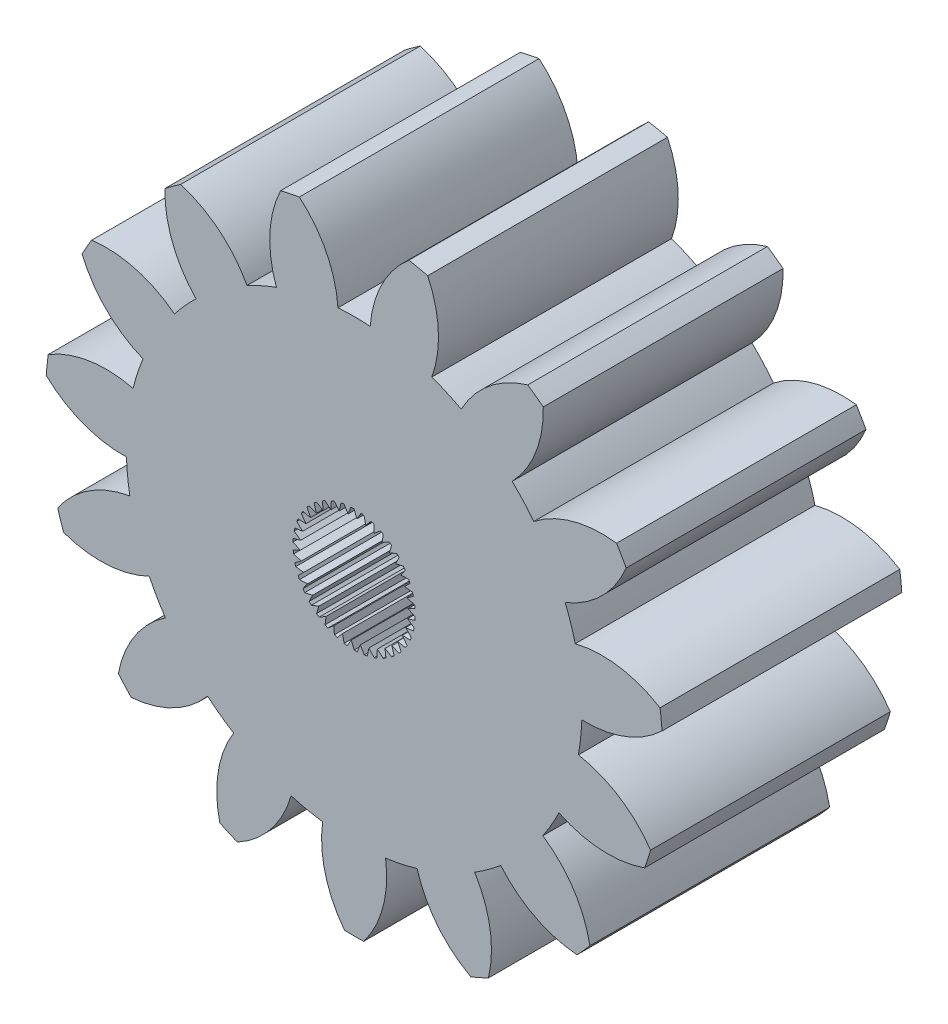
from build123d import *

# Parameters (mm, degrees)
SKETCH1_R           = 70.548036847
BOSS_EXTRUDE1_DEPTH = 10
SKETCH3_R           = 367.512428381
SKETCH3_R_2         = 2.249999999
CUT_EXTRUDE2_DEPTH  = 269.283414963
CUT_EXTRUDE4_DEPTH  = 10


with BuildPart() as part:
    # Sketch1 → Boss-Extrude1 (new body)
    with BuildSketch(Plane.XY):
        Circle(SKETCH1_R)
    extrude(amount=BOSS_EXTRUDE1_DEPTH)

    # Sketch3 → Cut-Extrude2 (cut, through all)
    # profile 1 of 2: a face of its own
    with BuildSketch(Plane(origin=(55.025604462, -141.718387499, 105.594585314), x_dir=(1, 0, 0), z_dir=(0, 0, 1))):
        with Locations((-43.461576529, 148.105383059)):
            Circle(SKETCH3_R)
        with BuildLine():
            ThreePointArc((-38.992966758, 156.489924055), (-37.834855129, 157.900828095), (-36.221197708, 158.75404699))
            ThreePointArc((-36.221197708, 158.75404699), (-35.892665836, 158.523094895), (-35.571495409, 158.28201064))
            ThreePointArc((-35.571495409, 158.28201064), (-35.884307233, 156.483672095), (-36.868280539, 154.946249158))
            ThreePointArc((-36.868280539, 154.946249158), (-36.400957542, 154.46279295), (-35.968998313, 153.947495063))
            ThreePointArc((-35.968998313, 153.947495063), (-34.337144321, 154.765373604), (-32.515959525, 154.888494247))
            ThreePointArc((-32.515959525, 154.888494247), (-32.309767405, 154.543883059), (-32.114421421, 154.193009851))
            ThreePointArc((-32.114421421, 154.193009851), (-33.131639425, 152.677377874), (-34.655870014, 151.673090132))
            ThreePointArc((-34.655870014, 151.673090132), (-34.425588568, 151.041353522), (-34.240564709, 150.394911831))
            ThreePointArc((-34.240564709, 150.394911831), (-32.417130735, 150.478346243), (-30.703317959, 149.850079957))
            ThreePointArc((-30.703317959, 149.850079957), (-30.655118083, 149.45139608), (-30.619373638, 149.051403086))
            ThreePointArc((-30.619373638, 149.051403086), (-32.165111587, 148.080544213), (-33.966046142, 147.783042142))
            ThreePointArc((-33.966046142, 147.783042142), (-34.012624001, 147.112258129), (-34.106527818, 146.446448275))
            ThreePointArc((-34.106527818, 146.446448275), (-32.406802162, 145.78101199), (-31.096695206, 144.509991723))
            ThreePointArc((-31.096695206, 144.509991723), (-31.214821769, 144.126171222), (-31.344859402, 143.746220863))
            ThreePointArc((-31.344859402, 143.746220863), (-33.151845162, 143.488005415), (-34.918085739, 143.948729825))
            ThreePointArc((-34.918085739, 143.948729825), (-35.233469168, 143.354883059), (-35.590063838, 142.784829614))
            ThreePointArc((-35.590063838, 142.784829614), (-34.307944507, 141.485582611), (-33.628072765, 139.791579314))
            ThreePointArc((-33.628072765, 139.791579314), (-33.892100612, 139.488988241), (-34.165435634, 139.194777386))
            ThreePointArc((-34.165435634, 139.194777386), (-35.921224952, 139.693853159), (-37.347372508, 140.833140613))
            ThreePointArc((-37.347372508, 140.833140613), (-37.877028847, 140.418912595), (-38.434655913, 140.04318298))
            ThreePointArc((-38.434655913, 140.04318298), (-37.791832987, 138.334776868), (-37.859752459, 136.510699101))
            ThreePointArc((-37.859752459, 136.510699101), (-38.224028776, 136.341658201), (-38.59339908, 136.184058581))
            ThreePointArc((-38.59339908, 136.184058581), (-39.994400032, 137.354130839), (-40.833860699, 138.974988187))
            ThreePointArc((-40.833860699, 138.974988187), (-41.486207555, 138.812002704), (-42.14844823, 138.695563981))
            ThreePointArc((-42.14844823, 138.695563981), (-42.256071633, 136.873397699), (-43.060038426, 135.234645079))
            ThreePointArc((-43.060038426, 135.234645079), (-43.461576529, 135.228383059), (-43.863114633, 135.234645079))
            ThreePointArc((-43.863114633, 135.234645079), (-44.667081426, 136.873397699), (-44.774704828, 138.695563981))
            ThreePointArc((-44.774704828, 138.695563981), (-45.436945504, 138.812002704), (-46.08929236, 138.974988187))
            ThreePointArc((-46.08929236, 138.974988187), (-46.928753027, 137.354130839), (-48.329753979, 136.184058581))
            ThreePointArc((-48.329753979, 136.184058581), (-48.699124282, 136.341658201), (-49.0634006, 136.510699101))
            ThreePointArc((-49.0634006, 136.510699101), (-49.131320072, 138.334776868), (-48.488497146, 140.04318298))
            ThreePointArc((-48.488497146, 140.04318298), (-49.046124211, 140.418912595), (-49.575780551, 140.833140613))
            ThreePointArc((-49.575780551, 140.833140613), (-51.001928107, 139.693853159), (-52.757717425, 139.194777386))
            ThreePointArc((-52.757717425, 139.194777386), (-53.031052447, 139.488988241), (-53.295080294, 139.791579314))
            ThreePointArc((-53.295080294, 139.791579314), (-52.615208552, 141.485582611), (-51.33308922, 142.784829614))
            ThreePointArc((-51.33308922, 142.784829614), (-51.689683891, 143.354883059), (-52.00506732, 143.948729825))
            ThreePointArc((-52.00506732, 143.948729825), (-53.771307897, 143.488005415), (-55.578293657, 143.746220863))
            ThreePointArc((-55.578293657, 143.746220863), (-55.70833129, 144.126171222), (-55.826457853, 144.509991723))
            ThreePointArc((-55.826457853, 144.509991723), (-54.516350896, 145.78101199), (-52.81662524, 146.446448275))
            ThreePointArc((-52.81662524, 146.446448275), (-52.910529057, 147.112258129), (-52.957106916, 147.783042142))
            ThreePointArc((-52.957106916, 147.783042142), (-54.758041472, 148.080544213), (-56.303779421, 149.051403086))
            ThreePointArc((-56.303779421, 149.051403086), (-56.268034976, 149.45139608), (-56.219835099, 149.850079957))
            ThreePointArc((-56.219835099, 149.850079957), (-54.506022324, 150.478346243), (-52.68258835, 150.394911831))
            ThreePointArc((-52.68258835, 150.394911831), (-52.497564491, 151.041353522), (-52.267283045, 151.673090132))
            ThreePointArc((-52.267283045, 151.673090132), (-53.791513634, 152.677377874), (-54.808731637, 154.193009851))
            ThreePointArc((-54.808731637, 154.193009851), (-54.613385654, 154.543883059), (-54.407193534, 154.888494247))
            ThreePointArc((-54.407193534, 154.888494247), (-52.586008737, 154.765373604), (-50.954154746, 153.947495063))
            ThreePointArc((-50.954154746, 153.947495063), (-50.522195516, 154.46279295), (-50.054872519, 154.946249158))
            ThreePointArc((-50.054872519, 154.946249158), (-51.038845826, 156.483672095), (-51.35165765, 158.28201064))
            ThreePointArc((-51.35165765, 158.28201064), (-51.030487223, 158.523094895), (-50.701955351, 158.75404699))
            ThreePointArc((-50.701955351, 158.75404699), (-49.088297929, 157.900828095), (-47.9301863, 156.489924055))
            ThreePointArc((-47.9301863, 156.489924055), (-47.325981375, 156.784978452), (-46.702421219, 157.036560288))
            ThreePointArc((-46.702421219, 157.036560288), (-46.975999319, 158.841284028), (-46.530316957, 160.611380068))
            ThreePointArc((-46.530316957, 160.611380068), (-46.138855372, 160.700989714), (-45.744789892, 160.778349))
            ThreePointArc((-45.744789892, 160.778349), (-44.617675874, 159.342561151), (-44.133554629, 157.582589738))
            ThreePointArc((-44.133554629, 157.582589738), (-43.461576529, 157.606383059), (-42.78959843, 157.582589738))
            ThreePointArc((-42.78959843, 157.582589738), (-42.305477184, 159.342561151), (-41.178363166, 160.778349))
            ThreePointArc((-41.178363166, 160.778349), (-40.784297687, 160.700989714), (-40.392836101, 160.611380068))
            ThreePointArc((-40.392836101, 160.611380068), (-39.94715374, 158.841284028), (-40.22073184, 157.036560288))
            ThreePointArc((-40.22073184, 157.036560288), (-39.597171683, 156.784978452), (-38.992966758, 156.489924055))
        make_face(mode=Mode.SUBTRACT)
    # profile 2 of 2: a face of its own
    with BuildSketch(Plane(origin=(55.025604462, -141.718387499, 105.594585314), x_dir=(1, 0, 0), z_dir=(0, 0, 1))):
        with Locations((-43.461576529, 148.105383059)):
            Circle(SKETCH3_R_2)
    extrude(amount=-CUT_EXTRUDE2_DEPTH, mode=Mode.SUBTRACT)

    # Sketch4 → Cut-Extrude4 (cut)
    with BuildSketch(Plane.XY.offset(10)):
        with BuildLine():
            Line((9.127956815, 5.633299661), (9.459541206, 5.590983238))
            Line((9.459541206, 5.590983238), (9.229545605, 5.360987637))
            ThreePointArc((9.229545605, 5.360987637), (9.256631551, 5.301444117), (9.285235917, 5.242614963))
            Line((9.285235918, 5.242614963), (9.619262985, 5.255452678))
            Line((9.619262985, 5.255452678), (9.430260255, 4.990737885))
            ThreePointArc((9.430260255, 4.990737885), (9.466777325, 4.936464662), (9.504674526, 4.883145985))
            Line((9.504674527, 4.883145986), (9.832032881, 4.950787659))
            Line((9.832032881, 4.950787659), (9.689178526, 4.658574404))
            ThreePointArc((9.689178525, 4.658574403), (9.734130628, 4.611051908), (9.780286927, 4.564698102))
            Line((9.780286928, 4.564698104), (10.092047088, 4.685298647))
            Line((10.092047088, 4.685298647), (9.9992378, 4.373557746))
            ThreePointArc((9.999237799, 4.373557744), (10.051398761, 4.334082267), (10.104555133, 4.295957744))
            Line((10.104555135, 4.295957747), (10.392213095, 4.466227491))
            Line((10.392213095, 4.466227491), (10.351980471, 4.143462423))
            ThreePointArc((10.35198047, 4.143462421), (10.409927474, 4.11311075), (10.468633953, 4.084255447))
            Line((10.468633954, 4.08425545), (10.724343156, 4.299549882))
            Line((10.724343156, 4.299549882), (10.737784637, 3.974564836))
            ThreePointArc((10.737784636, 3.974564833), (10.799937039, 3.954164883), (10.862592265, 3.935365897))
            Line((10.862592266, 3.935365901), (11.079377628, 4.189812348))
            Line((11.079377628, 4.189812348), (11.146126565, 3.87147207))
            ThreePointArc((11.146126565, 3.871472067), (11.210789012, 3.861580294), (11.275683913, 3.853350414))
            Line((11.275683914, 3.853350418), (11.447632098, 4.140008246))
            Line((11.447632098, 4.140008246), (11.565867754, 3.836996228))
            ThreePointArc((11.565867754, 3.836996224), (11.631276422, 3.837882452), (11.696640835, 3.840446166))
            Line((11.696640835, 3.84044617), (11.819061542, 4.1514961))
            Line((11.819061542, 4.1514961), (11.985558757, 3.87207772))
            ThreePointArc((11.985558758, 3.872077716), (12.049929468, 3.88371777), (12.113980423, 3.897005147))
            Line((12.113980422, 3.897005151), (12.183534335, 4.223962551))
            Line((12.183534335, 4.223962551), (12.393751498, 3.975759615))
            ThreePointArc((12.3937515, 3.975759611), (12.455328387, 3.99783598), (12.51631874, 4.021484576))
            Line((12.516318738, 4.02148458), (12.531108607, 4.355430905))
            Line((12.531108607, 4.355430905), (12.779311543, 4.145213741))
            ThreePointArc((12.779311545, 4.145213738), (12.836414954, 4.177124237), (12.892681047, 4.210488978))
            Line((12.892681044, 4.210488982), (12.85230344, 4.542315047))
            Line((12.85230344, 4.542315047), (13.13172182, 4.375817832))
            ThreePointArc((13.131721822, 4.375817829), (13.182794119, 4.416692022), (13.232801159, 4.458862807))
            Line((13.232801157, 4.45886281), (13.138357475, 4.779517264))
            Line((13.138357475, 4.779517264), (13.441369493, 4.661281608))
            ThreePointArc((13.441369495, 4.661281605), (13.485017562, 4.710004552), (13.527401488, 4.75983107))
            Line((13.527401486, 4.759831073), (13.381467904, 5.060567299))
            Line((13.381467904, 5.060567299), (13.699808183, 4.993818362))
            ThreePointArc((13.699808185, 4.99381836), (13.734841415, 5.049061025), (13.768446105, 5.10518414))
            Line((13.768446102, 5.105184141), (13.575003309, 5.37779884))
            Line((13.575003309, 5.37779884), (13.899988354, 5.364357359))
            ThreePointArc((13.899988357, 5.364357358), (13.925451135, 5.424612864), (13.94935994, 5.485501683))
            Line((13.949359937, 5.485501684), (13.713684547, 5.722558636))
            Line((13.713684547, 5.722558636), (14.036449615, 5.76279126))
            ThreePointArc((14.036449617, 5.762791259), (14.051647386, 5.826415995), (14.065208136, 5.890409629))
            Line((14.065208134, 5.89040963), (13.793728757, 6.08544254))
            Line((13.793728757, 6.08544254), (14.105469658, 6.178251827))
            ThreePointArc((14.105469659, 6.178251827), (14.109987863, 6.243510275), (14.112830656, 6.308863145))
            Line((14.112830654, 6.308863145), (13.81295254, 6.456552024))
            Line((13.81295254, 6.456552024), (14.105165795, 6.599406379))
            ThreePointArc((14.105165796, 6.599406379), (14.09888119, 6.664518459), (14.090928481, 6.72944791))
            Line((14.09092848, 6.72944791), (13.770831523, 6.825764189))
            Line((13.770831523, 6.825764189), (14.035546316, 7.014766918))
            ThreePointArc((14.035546315, 7.014766918), (14.018630327, 7.077956542), (14.000099047, 7.140691467))
            Line((14.000099047, 7.140691467), (13.668514656, 7.18300789))
            Line((13.668514656, 7.18300789), (13.898510257, 7.413003491))
            ThreePointArc((13.898510256, 7.413003491), (13.87142431, 7.47254701), (13.842819943, 7.531376164))
            Line((13.842819944, 7.531376164), (13.508792877, 7.518538449))
            Line((13.508792877, 7.518538449), (13.697795607, 7.783253242))
            ThreePointArc((13.697795605, 7.783253241), (13.661278535, 7.837526464), (13.623381334, 7.890845141))
            Line((13.623381335, 7.890845142), (13.296022981, 7.823203469))
            Line((13.296022981, 7.823203469), (13.438877336, 8.115416724))
            ThreePointArc((13.438877335, 8.115416722), (13.393925231, 8.162939217), (13.347768932, 8.209293022))
            Line((13.347768933, 8.209293024), (13.036008774, 8.08869248))
            Line((13.036008774, 8.08869248), (13.128818062, 8.400433382))
            ThreePointArc((13.12881806, 8.400433379), (13.076657098, 8.439908856), (13.023500726, 8.478033379))
            Line((13.023500727, 8.478033381), (12.735842767, 8.307763636))
            Line((12.735842767, 8.307763636), (12.776075391, 8.630528705))
            ThreePointArc((12.776075389, 8.630528701), (12.718128385, 8.660880372), (12.659421906, 8.689735675))
            Line((12.659421908, 8.689735678), (12.403712706, 8.474441246))
            Line((12.403712706, 8.474441246), (12.390271225, 8.799426292))
            ThreePointArc((12.390271224, 8.799426288), (12.328118821, 8.819826238), (12.265463595, 8.838625223))
            Line((12.265463596, 8.838625227), (12.048678233, 8.584178779))
            Line((12.048678233, 8.584178779), (11.981929297, 8.902519058))
            ThreePointArc((11.981929296, 8.902519053), (11.917266849, 8.912410825), (11.852371948, 8.920640705))
            Line((11.852371948, 8.920640709), (11.680423764, 8.633982882))
            Line((11.680423764, 8.633982882), (11.562188108, 8.9369949))
            ThreePointArc((11.562188108, 8.936994895), (11.49677944, 8.936108667), (11.431415027, 8.933544953))
            Line((11.431415027, 8.933544957), (11.308994319, 8.622495028))
            Line((11.308994319, 8.622495028), (11.142497105, 8.901913408))
            ThreePointArc((11.142497105, 8.901913403), (11.078126395, 8.890273349), (11.014075441, 8.876985972))
            Line((11.01407544, 8.876985976), (10.944521527, 8.550028576))
            Line((10.944521527, 8.550028576), (10.734304364, 8.798231513))
            ThreePointArc((10.734304365, 8.798231508), (10.672727478, 8.776155139), (10.611737125, 8.752506543))
            Line((10.611737123, 8.752506548), (10.596947255, 8.418560223))
            Line((10.596947255, 8.418560223), (10.348744319, 8.628777386))
            ThreePointArc((10.348744321, 8.628777382), (10.291640913, 8.596866884), (10.23537482, 8.563502142))
            Line((10.235374818, 8.563502146), (10.275752422, 8.231676081))
            Line((10.275752422, 8.231676081), (9.996334042, 8.398173296))
            ThreePointArc((9.996334045, 8.398173292), (9.945261748, 8.357299099), (9.895254708, 8.315128315))
            Line((9.895254705, 8.315128318), (9.989698387, 7.994473863))
            Line((9.989698387, 7.994473863), (9.686686369, 8.11270952))
            ThreePointArc((9.686686372, 8.112709517), (9.643038306, 8.063986571), (9.600654379, 8.014160053))
            Line((9.600654376, 8.014160055), (9.746587958, 7.713423828))
            Line((9.746587958, 7.713423828), (9.428247679, 7.780172766))
            ThreePointArc((9.428247683, 7.780172763), (9.393214453, 7.724930099), (9.359609763, 7.668806985))
            Line((9.35960976, 7.668806986), (9.553052553, 7.396192288))
            Line((9.553052553, 7.396192288), (9.228067507, 7.409633769))
            ThreePointArc((9.228067511, 7.409633768), (9.202604732, 7.349378261), (9.178695927, 7.288489443))
            Line((9.178695925, 7.288489444), (9.414371315, 7.051432492))
            Line((9.414371315, 7.051432492), (9.091606247, 7.011199868))
            ThreePointArc((9.091606249, 7.011199867), (9.07640848, 6.947575132), (9.06284773, 6.883581497))
            Line((9.062847728, 6.883581498), (9.334327105, 6.688548588))
            Line((9.334327105, 6.688548588), (9.022586204, 6.595739301))
            ThreePointArc((9.022586206, 6.595739301), (9.018068002, 6.530480853), (9.015225209, 6.465127982))
            Line((9.015225208, 6.465127982), (9.315103322, 6.317439104))
            Line((9.315103322, 6.317439104), (9.022890067, 6.174584748))
            ThreePointArc((9.022890068, 6.174584749), (9.029174674, 6.109472669), (9.037127382, 6.044543218))
            Line((9.037127381, 6.044543218), (9.357224339, 5.948226939))
            Line((9.357224339, 5.948226939), (9.092509546, 5.75922421))
            ThreePointArc((9.092509547, 5.75922421), (9.109425535, 5.696034586), (9.127956815, 5.633299661))
        make_face()
    extrude(amount=-CUT_EXTRUDE4_DEPTH, mode=Mode.SUBTRACT)


solid = part.part
